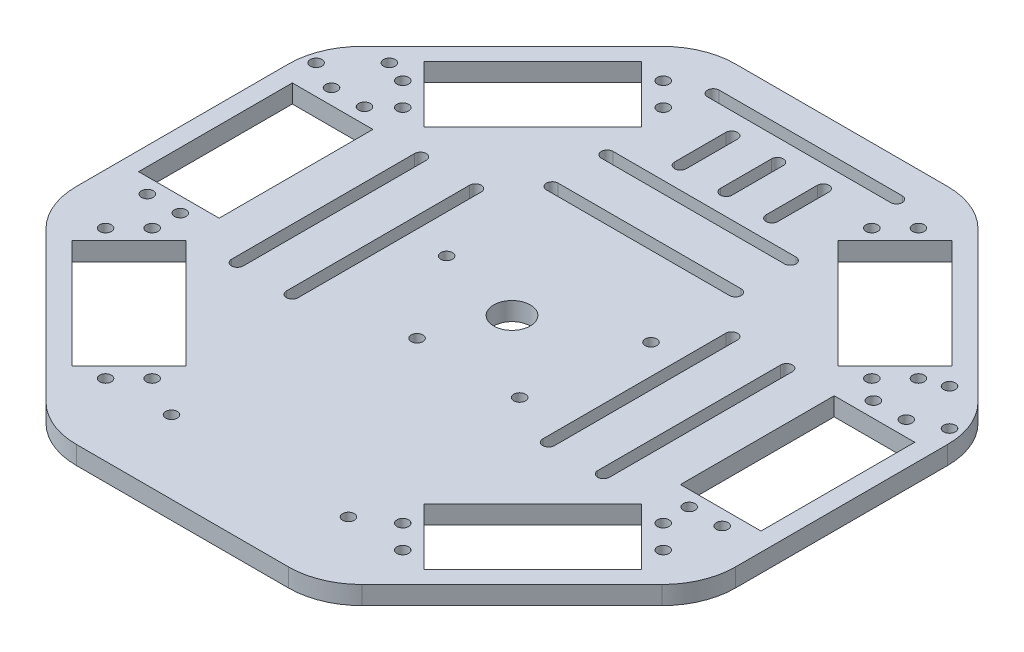
from build123d import *

# Parameters (mm, degrees)
BASEPLATE_DEPTH            = 5
FILLET1_R                  = 20
SKETCH2_W                  = 22
SKETCH2_H                  = 42
SKETCH2_R                  = 1.6
SERVO_HOLE_DEPTH           = 128.377392029
SKETCH3_R                  = 5
CENTER_HOLE_DEPTH          = 128.377392029
SERVO_HOLE_PATTERN_COUNT   = 8
SKETCH4_R                  = 1.6
ARDUINO_SCREW_HOLES_DEPTH  = 128.377392029
MIRROR1_COPY_1_SKETCH_W    = 22
MIRROR1_COPY_1_SKETCH_H    = 42
MIRROR1_COPY_1_SKETCH_R    = 1.6
MIRROR1_COPY_1_DEPTH       = 128.377392029
MIRROR1_COPY_2_SKETCH_W    = 22
MIRROR1_COPY_2_SKETCH_H    = 42
MIRROR1_COPY_2_SKETCH_R    = 1.6
MIRROR1_COPY_2_DEPTH       = 128.377392029
SLITS_DEPTH                = 128.377392029
SKETCH6_R                  = 1.6
EXTERIOR_SCREW_HOLES_DEPTH = 128.377392029


with BuildPart() as part:
    # Sketch1 → Baseplate (new body)
    with BuildSketch(Plane(origin=(0, 0, 0), x_dir=(1, 0, 0), z_dir=(0, 1, 0))):
        Polygon((-90, 37.279220614), (-90, -37.279220614), (-37.279220614, -90), (37.279220614, -90), (90, -37.279220614), (90, 37.279220614), (37.279220614, 90), (-37.279220614, 90), align=None)
    extrude(amount=BASEPLATE_DEPTH)

    # Fillet1
    fillet1_edges = [part.edges().sort_by_distance(p)[0] for p in [
        (-90, 2.5, -37.279220614),
        (-37.279220614, 2.5, -90),
        (37.279220614, 2.5, -90),
        (90, 2.5, -37.279220614),
        (90, 2.5, 37.279220614),
        (37.279220614, 2.5, 90),
        (-37.279220614, 2.5, 90),
        (-90, 2.5, 37.279220614),
    ]]
    fillet(fillet1_edges, radius=FILLET1_R)

    # Sketch2 → Servo hole (cut, through all)
    with BuildSketch(Plane(origin=(0, 5, 0), x_dir=(1, 0, 0), z_dir=(0, 1, 0))):
        with Locations((74, 4.005050634)):
            Rectangle(SKETCH2_W, SKETCH2_H)
        with Locations((78.5, 29.205050634)):
            Circle(SKETCH2_R)
        with Locations((69.5, 29.205050634)):
            Circle(SKETCH2_R)
        with Locations((69.5, -21.094949366)):
            Circle(SKETCH2_R)
        with Locations((78.5, -21.094949366)):
            Circle(SKETCH2_R)
    servo_hole = extrude(amount=-SERVO_HOLE_DEPTH, mode=Mode.SUBTRACT)

    # Sketch3 → Center hole (cut, through all)
    with BuildSketch(Plane(origin=(0, 5, 0), x_dir=(1, 0, 0), z_dir=(0, 1, 0))):
        Circle(SKETCH3_R)
    extrude(amount=-CENTER_HOLE_DEPTH, mode=Mode.SUBTRACT)

    # Servo hole pattern: Servo hole ×8 about axis, 5 skipped
    servo_hole_pattern_axis = Axis((0, 5, 0), (0, 1, 0))
    add([servo_hole.rotate(servo_hole_pattern_axis, i * 360 / SERVO_HOLE_PATTERN_COUNT) for i in range(1, SERVO_HOLE_PATTERN_COUNT) if i not in (2, 3, 4, 5, 6)], mode=Mode.SUBTRACT)

    # Sketch4 → Arduino Screw holes (cut, through all)
    with BuildSketch(Plane(origin=(0, 5, 0), x_dir=(1, 0, 0), z_dir=(0, 1, 0))):
        with Locations((-23, 5.1332)):
            Circle(SKETCH4_R)
        with Locations((-23, -70)):
            Circle(SKETCH4_R)
        with Locations((25.3362, 12.6262)):
            Circle(SKETCH4_R)
        with Locations((25.3362, -70)):
            Circle(SKETCH4_R)
        with Locations((-7.55849277, -18.3745)):
            Circle(SKETCH4_R)
        with Locations((20.45770723, -18.3745)):
            Circle(SKETCH4_R)
    extrude(amount=-ARDUINO_SCREW_HOLES_DEPTH, mode=Mode.SUBTRACT)

    # Mirror1: Servo hole across plane
    add(servo_hole.mirror(Plane(origin=(0, 0, 0), x_dir=(0, 0, 1), z_dir=(1, 0, 0))), mode=Mode.SUBTRACT)

    # Mirror1 copy 1 sketch → Mirror1 copy 1 (cut, through all)
    with BuildSketch(Plane(origin=(0, 5, 0), x_dir=(-0.7071067811865476, 0, -0.7071067811865475), z_dir=(0, 1, 0))):
        with Locations((74, -4.005050634)):
            Rectangle(MIRROR1_COPY_1_SKETCH_W, MIRROR1_COPY_1_SKETCH_H)
        with Locations((78.5, -29.205050634)):
            Circle(MIRROR1_COPY_1_SKETCH_R)
        with Locations((69.5, -29.205050634)):
            Circle(MIRROR1_COPY_1_SKETCH_R)
        with Locations((69.5, 21.094949366)):
            Circle(MIRROR1_COPY_1_SKETCH_R)
        with Locations((78.5, 21.094949366)):
            Circle(MIRROR1_COPY_1_SKETCH_R)
    extrude(amount=-MIRROR1_COPY_1_DEPTH, mode=Mode.SUBTRACT)

    # Mirror1 copy 2 sketch → Mirror1 copy 2 (cut, through all)
    with BuildSketch(Plane(origin=(0, 5, 0), x_dir=(-0.7071067811865474, 0, 0.7071067811865477), z_dir=(0, 1, 0))):
        with Locations((74, -4.005050634)):
            Rectangle(MIRROR1_COPY_2_SKETCH_W, MIRROR1_COPY_2_SKETCH_H)
        with Locations((78.5, -29.205050634)):
            Circle(MIRROR1_COPY_2_SKETCH_R)
        with Locations((69.5, -29.205050634)):
            Circle(MIRROR1_COPY_2_SKETCH_R)
        with Locations((69.5, 21.094949366)):
            Circle(MIRROR1_COPY_2_SKETCH_R)
        with Locations((78.5, 21.094949366)):
            Circle(MIRROR1_COPY_2_SKETCH_R)
    extrude(amount=-MIRROR1_COPY_2_DEPTH, mode=Mode.SUBTRACT)

    # Sketch5 → Slits (cut, through all)
    with BuildSketch(Plane(origin=(0, 5, 0), x_dir=(1, 0, 0), z_dir=(0, 1, 0))):
        with BuildLine():
            Line((25, 37.6), (-25, 37.6))
            ThreePointArc((-25, 37.6), (-26.6, 36), (-25, 34.4))
            Line((-25, 34.4), (25, 34.4))
            ThreePointArc((25, 34.4), (26.6, 36), (25, 37.6))
        make_face()
        with BuildLine():
            Line((25, 52.6), (-25, 52.6))
            ThreePointArc((-25, 52.6), (-26.6, 51), (-25, 49.4))
            Line((-25, 49.4), (25, 49.4))
            ThreePointArc((25, 49.4), (26.6, 51), (25, 52.6))
        make_face()
        with BuildLine():
            Line((-48.4, -25), (-48.4, 25))
            ThreePointArc((-48.4, 25), (-50, 26.6), (-51.6, 25))
            Line((-51.6, 25), (-51.6, -25))
            ThreePointArc((-51.6, -25), (-50, -26.6), (-48.4, -25))
        make_face()
        with BuildLine():
            Line((-33.4, -25), (-33.4, 25))
            ThreePointArc((-33.4, 25), (-35, 26.6), (-36.6, 25))
            Line((-36.6, 25), (-36.6, -25))
            ThreePointArc((-36.6, -25), (-35, -26.6), (-33.4, -25))
        make_face()
        with BuildLine():
            Line((36.6, -25), (36.6, 25))
            ThreePointArc((36.6, 25), (35, 26.6), (33.4, 25))
            Line((33.4, 25), (33.4, -25))
            ThreePointArc((33.4, -25), (35, -26.6), (36.6, -25))
        make_face()
        with BuildLine():
            Line((51.6, -25), (51.6, 25))
            ThreePointArc((51.6, 25), (50, 26.6), (48.4, 25))
            Line((48.4, 25), (48.4, -25))
            ThreePointArc((48.4, -25), (50, -26.6), (51.6, -25))
        make_face()
        with BuildLine():
            Line((25, 81.6), (-25, 81.6))
            ThreePointArc((-25, 81.6), (-26.6, 80), (-25, 78.4))
            Line((-25, 78.4), (25, 78.4))
            ThreePointArc((25, 78.4), (26.6, 80), (25, 81.6))
        make_face()
        with BuildLine():
            Line((-10.9, 58.5), (-10.9, 72.5))
            ThreePointArc((-10.9, 72.5), (-12.5, 74.1), (-14.1, 72.5))
            Line((-14.1, 72.5), (-14.1, 58.5))
            ThreePointArc((-14.1, 58.5), (-12.5, 56.9), (-10.9, 58.5))
        make_face()
        with BuildLine():
            Line((14.1, 58.5), (14.1, 72.5))
            ThreePointArc((14.1, 72.5), (12.5, 74.1), (10.9, 72.5))
            Line((10.9, 72.5), (10.9, 58.5))
            ThreePointArc((10.9, 58.5), (12.5, 56.9), (14.1, 58.5))
        make_face()
        with BuildLine():
            Line((1.6, 58.5), (1.6, 72.5))
            ThreePointArc((1.6, 72.5), (0, 74.1), (-1.6, 72.5))
            Line((-1.6, 72.5), (-1.6, 58.5))
            ThreePointArc((-1.6, 58.5), (0, 56.9), (1.6, 58.5))
        make_face()
    extrude(amount=-SLITS_DEPTH, mode=Mode.SUBTRACT)

    # Sketch6 → Exterior Screw Holes (cut, through all)
    with BuildSketch(Plane(origin=(0, 5, 0), x_dir=(1, 0, 0), z_dir=(0, 1, 0))):
        with Locations((-76.5, 43)):
            Circle(SKETCH6_R)
        with Locations((-86.5, 33)):
            Circle(SKETCH6_R)
    exterior_screw_holes = extrude(amount=-EXTERIOR_SCREW_HOLES_DEPTH, mode=Mode.SUBTRACT)

    # Mirror2: Exterior Screw Holes across plane
    add(exterior_screw_holes.mirror(Plane(origin=(0, 0, 0), x_dir=(0, 0, 1), z_dir=(1, 0, 0))), mode=Mode.SUBTRACT)


solid = part.part
